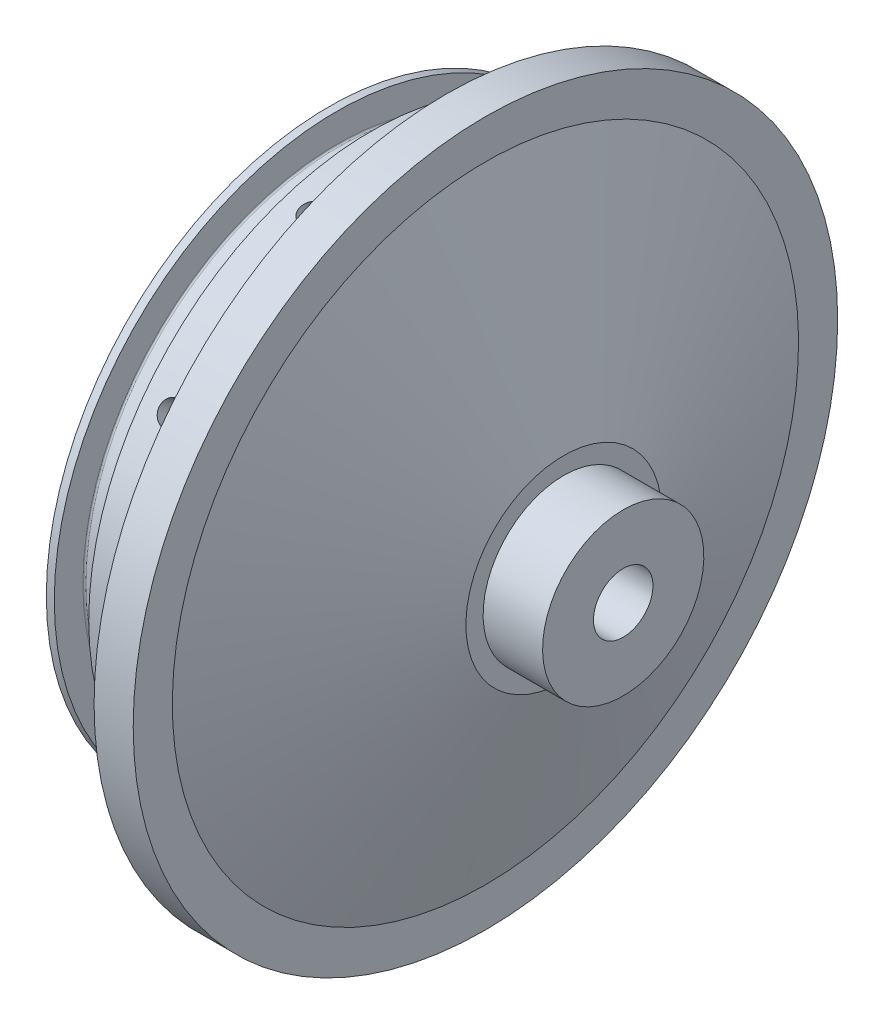
from build123d import *

# Parameters (mm, degrees)
SKETCH1_R           = 57.15
BOSS_EXTRUDE1_DEPTH = 6.35
SKETCH2_R           = 45.847
BOSS_EXTRUDE2_DEPTH = 19.05
SKETCH3_R           = 38.227
CUT_EXTRUDE1_DEPTH  = 6.604
SKETCH6_R           = 13.081
BOSS_EXTRUDE3_DEPTH = 9.652
SKETCH7_R           = 4.826
CUT_EXTRUDE2_DEPTH  = 94.87490881
FILLET1_R           = 2.032
SKETCH11_R          = 1.89865
CUT_EXTRUDE3_DEPTH  = 11.43
CIRPATTERN1_COUNT   = 10
SKETCH14_R          = 1.1303
CUT_EXTRUDE4_DEPTH  = 6.35
CIRPATTERN2_COUNT   = 8


with BuildPart() as part:
    # Sketch1 → Boss-Extrude1 (new body)
    with BuildSketch(Plane(origin=(0, 0, 0), x_dir=(0, 0, -1), z_dir=(1, 0, 0))):
        Circle(SKETCH1_R)
    extrude(amount=BOSS_EXTRUDE1_DEPTH)

    # Sketch2 → Boss-Extrude2 (add)
    with BuildSketch(Plane.ZY):
        Circle(SKETCH2_R)
    extrude(amount=BOSS_EXTRUDE2_DEPTH)

    # Sketch3 → Cut-Extrude1 (cut)
    with BuildSketch(Plane.ZY.offset(19.05)):
        Circle(SKETCH3_R)
    extrude(amount=-CUT_EXTRUDE1_DEPTH, mode=Mode.SUBTRACT)

    # Sketch5 → Revolve1 (revolve)
    with BuildSketch(Plane.XY):
        Polygon((6.35, -50.8), (19.05, -15.875), (19.05, 0), (6.35, 0), align=None)
    revolve(axis=Axis((6.35, 0, 0), (1, 0, 0)))

    # Sketch6 → Boss-Extrude3 (add)
    with BuildSketch(Plane(origin=(19.05, 0, 0), x_dir=(0, 0, -1), z_dir=(1, 0, 0))):
        Circle(SKETCH6_R)
    extrude(amount=BOSS_EXTRUDE3_DEPTH)

    # Sketch7 → Cut-Extrude2 (cut, through all)
    with BuildSketch(Plane(origin=(28.702, 0, 0), x_dir=(0, 0, -1), z_dir=(1, 0, 0))):
        Circle(SKETCH7_R)
    extrude(amount=-CUT_EXTRUDE2_DEPTH, mode=Mode.SUBTRACT)

    # Sketch8 → Cut-Revolve2 (revolve, cut)
    with BuildSketch(Plane.XY):
        Polygon((0, 0), (-12.446, 0), (-12.446, -29.21), (-2.794, -29.21), (10.414, -15.875), (10.414, 0), align=None)
    revolve(axis=Axis((10.414, 0, 0), (-1, 0, 0)), mode=Mode.SUBTRACT)

    # Fillet1
    fillet1_edges = [part.edges().sort_by_distance(p)[0] for p in [
        (-2.794, 29.21, 0),
        (10.414, 15.875, 0),
    ]]
    fillet(fillet1_edges, radius=FILLET1_R)

    # Sketch11 → Cut-Extrude3 (cut)
    with BuildSketch(Plane(origin=(0, 0, -45.847), x_dir=(-1, 0, 0), z_dir=(0, 0, -1))):
        with Locations((7.62, 0)):
            Circle(SKETCH11_R)
    cut_extrude3 = extrude(amount=-CUT_EXTRUDE3_DEPTH, mode=Mode.SUBTRACT)

    # CirPattern1: Cut-Extrude3 ×10 about axis
    cirpattern1_axis = Axis((0, 0, 0), (-1, 0, 0))
    for i in range(1, CIRPATTERN1_COUNT):
        add(cut_extrude3.rotate(cirpattern1_axis, i * 360 / CIRPATTERN1_COUNT), mode=Mode.SUBTRACT)

    # Sketch13 → Cut-Revolve3 (revolve, cut)
    with BuildSketch(Plane.XY):
        with BuildLine():
            Line((-17.757455489, 45.847), (-12.169455489, 45.847))
            Line((-12.169455489, 45.847), (-12.169455489, 41.2115))
            ThreePointArc((-12.169455489, 41.2115), (-12.243850367, 41.031894878), (-12.423455489, 40.9575))
            Line((-12.423455489, 40.9575), (-17.503455489, 40.9575))
            ThreePointArc((-17.503455489, 40.9575), (-17.683060611, 41.031894878), (-17.757455489, 41.2115))
            Line((-17.757455489, 41.2115), (-17.757455489, 45.847))
        make_face()
    revolve(axis=Axis((0, 0, 0), (-1, 0, 0)), mode=Mode.SUBTRACT)

    # Sketch14 → Cut-Extrude4 (cut)
    with BuildSketch(Plane.ZY.offset(12.446)):
        with Locations((0, 33.3375)):
            Circle(SKETCH14_R)
    cut_extrude4 = extrude(amount=-CUT_EXTRUDE4_DEPTH, mode=Mode.SUBTRACT)

    # CirPattern2: Cut-Extrude4 ×8 about axis
    cirpattern2_axis = Axis((-12.446, 0, 0), (1, 0, 0))
    for i in range(1, CIRPATTERN2_COUNT):
        add(cut_extrude4.rotate(cirpattern2_axis, i * 360 / CIRPATTERN2_COUNT), mode=Mode.SUBTRACT)


solid = part.part
